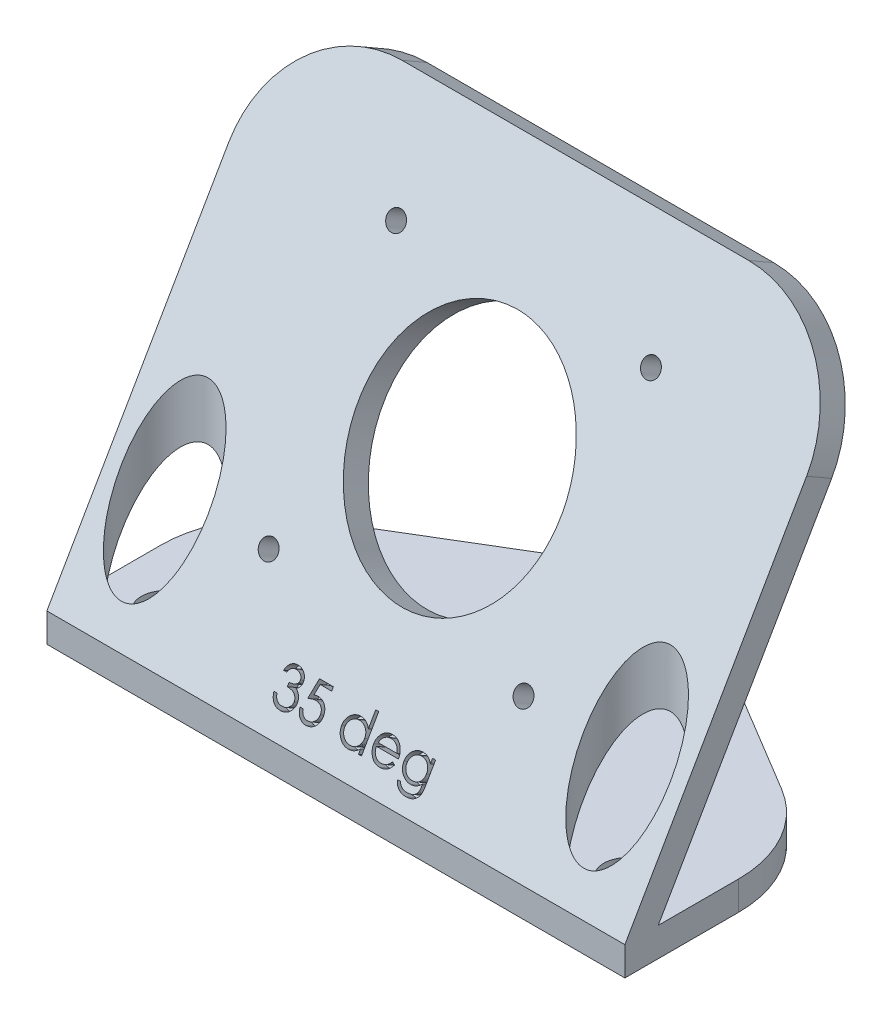
from build123d import *

# Parameters (mm, degrees)
BOSS_EXTRUDE1_DEPTH                             = 3.175
BOSS_EXTRUDE2_DEPTH                             = 31.75
FILLET1_R                                       = 6.35
SKETCH11_W                                      = 2.45745
SKETCH11_H                                      = 3.175
F_10_0_1935_DIAMETER_HOLE1_AT_2_COUNT           = 2
F_10_0_1935_DIAMETER_HOLE1_AT_2_PITCH           = 35.921024484
F_10_0_1935_DIAMETER_HOLE1_AT_3_COUNT           = 2
F_10_0_1935_DIAMETER_HOLE1_AT_3_PITCH           = 35.921024484
CUT_EXTRUDE2_REACH                              = 74.662
SKETCH13_RX                                     = 12.7
SKETCH13_RY                                     = 11.1125
CUT_EXTRUDE3_DEPTH                              = 1.27
SKETCH16_W                                      = 1.025
SKETCH16_H                                      = 25.965795256
M2_5X0_45_TAPPED_HOLE1_AT_2_COUNT               = 2
M2_5X0_45_TAPPED_HOLE1_AT_2_PITCH               = 28
M2_5X0_45_TAPPED_HOLE1_AT_3_COUNT               = 2
M2_5X0_45_TAPPED_HOLE1_AT_3_PITCH               = 28
M2_5X0_45_TAPPED_HOLE1_AT_4_COUNT               = 2
M2_5X0_45_TAPPED_HOLE1_AT_4_PITCH               = 39.597979746
BOSS_EXTRUDE3_START                             = 2.54
SKETCH19_R                                      = 2.38125
SKETCH19_R_2                                    = 1.025
BOSS_EXTRUDE3_DEPTH                             = 2.54
FILLET2_R                                       = 2.54
CBORE_FOR_10_SOCKET_HEAD_CAP_SCREW2_D           = 5.1054
CBORE_FOR_10_SOCKET_HEAD_CAP_SCREW2_CBORE_D     = 9.525
CBORE_FOR_10_SOCKET_HEAD_CAP_SCREW2_CBORE_DEPTH = 25.4
SKETCH23_W                                      = 6.35
SKETCH23_H                                      = 20.32
CUT_EXTRUDE4_DEPTH                              = 71.366754271
FILLET3_R                                       = 12.7


with BuildPart() as part:
    # Sketch1 → Boss-Extrude1 (new body)
    with BuildSketch(Plane(origin=(0, 0, 0), x_dir=(1, 0, 0), z_dir=(0, 1, 0))):
        Polygon((0, 38.770250599), (-38.1, 15.875), (-38.1, 0), (38.1, 0), (38.1, 15.875), align=None)
    extrude(amount=BOSS_EXTRUDE1_DEPTH)

    # Sketch3 → Boss-Extrude2 (add, symmetric)
    with BuildSketch(Plane(origin=(0, 0, 0), x_dir=(0, 0, -1), z_dir=(1, 0, 0))):
        Polygon((0, 3.175), (26.316543552, 48.756590512), (29.066174209, 47.169090512), (3.666174209, 3.175), align=None)
    extrude(amount=BOSS_EXTRUDE2_DEPTH, both=True)

    # Fillet1
    fillet1_edges = [part.edges().sort_by_distance(p)[0] for p in [
        (0, 1.5875, -38.770250599),
    ]]
    fillet(fillet1_edges, radius=FILLET1_R)

    # Sketch11 → #10 (0.1935) Diameter Hole1 (revolve, cut)
    with BuildSketch(Plane(origin=(0, 3.175, -31.996917266), x_dir=(0, 0, 1), z_dir=(1, 0, 0))):
        with Locations((1.228725, 1.5875)):
            Rectangle(SKETCH11_W, SKETCH11_H)
    f_10_0_1935_diameter_hole1 = revolve(axis=Axis((0, 9.525, -31.996917266), (0, -1, 0)), mode=Mode.SUBTRACT)

    # #10 (0.1935) Diameter Hole1 at 2: #10 (0.1935) Diameter Hole1 ×2
    with Locations(*[Vector(0.7071067811865541, 0, 0.7071067811865409) * (i * F_10_0_1935_DIAMETER_HOLE1_AT_2_PITCH) for i in range(1, F_10_0_1935_DIAMETER_HOLE1_AT_2_COUNT)]):
        add(f_10_0_1935_diameter_hole1, mode=Mode.SUBTRACT)

    # #10 (0.1935) Diameter Hole1 at 3: #10 (0.1935) Diameter Hole1 ×2
    with Locations(*[Vector(-0.707106781186551, 0, 0.707106781186544) * (i * F_10_0_1935_DIAMETER_HOLE1_AT_3_PITCH) for i in range(1, F_10_0_1935_DIAMETER_HOLE1_AT_3_COUNT)]):
        add(f_10_0_1935_diameter_hole1, mode=Mode.SUBTRACT)

    # Sketch13 → Cut-Extrude2 (cut, up to next)
    with BuildSketch(Plane(origin=(0, 0.79375, 1.374815329), x_dir=(1, 0, 0), z_dir=(0, 0.4999999999999981, 0.8660254037844397)), mode=Mode.PRIVATE) as cut_extrude2_sk1:
        with Locations(Location((0, 29.982717762), (0, 0, -90))):
            Ellipse(SKETCH13_RX, SKETCH13_RY)
    cut_extrude2_tool1 = extrude(cut_extrude2_sk1.sketch, amount=-CUT_EXTRUDE2_REACH, mode=Mode.PRIVATE) & part.part
    add(cut_extrude2_tool1.solids().sort_by_distance((0, 26.759545, -13.616544))[0], mode=Mode.SUBTRACT)

    # Sketch14 → Cut-Extrude3 (cut)
    # profile 1 of 5: a face of its own
    with BuildSketch(Plane(origin=(0, 0.79375, 1.374815329), x_dir=(1, 0, 0), z_dir=(0, 0.4999999999999981, 0.8660254037844397))):
        with BuildLine():
            Line((-8.096928419, 8.138989631), (-8.429353632, 8.138989631))
            add(Edge.make_bspline(
                [(-8.429353632, 8.138989631), (-8.420347691, 8.176277344), (-8.402741813, 8.249171771), (-8.366020214, 8.353319455), (-8.326016003, 8.451875182), (-8.2779792, 8.542993527), (-8.225582435, 8.628505699), (-8.165550889, 8.706472189), (-8.100654182, 8.778875911), (-8.028872777, 8.843130754), (-7.953594944, 8.901315517), (-7.873759971, 8.950924953), (-7.790974076, 8.993601348), (-7.704663676, 9.028759427), (-7.614571811, 9.055244773), (-7.52151296, 9.074460725), (-7.425243256, 9.086939655), (-7.359893722, 9.088157545), (-7.326711071, 9.088775956)],
                knots=[0, 0, 0, 0, 1.162005537, 2.271625781, 3.343758855, 4.383309926, 5.390229558, 6.379919256, 7.361854164, 8.333198761, 9.295911338, 10.242430842, 11.177959212, 12.116337295, 13.062827104, 14.020064771, 14.994644689, 16, 16, 16, 16], degree=3))
            add(Edge.make_bspline(
                [(-7.326711071, 9.088775956), (-7.278363502, 9.087316271), (-7.182722966, 9.08442874), (-7.042215408, 9.058060962), (-6.906720358, 9.01633603), (-6.777720904, 8.958684669), (-6.657898062, 8.887578095), (-6.551285598, 8.802948749), (-6.459328591, 8.706429488), (-6.382182041, 8.599820858), (-6.321777667, 8.485885443), (-6.277236255, 8.368621944), (-6.250119976, 8.248308524), (-6.24660572, 8.167073737), (-6.244845085, 8.126375282)],
                knots=[0, 0, 0, 0, 1.083050992, 2.142477498, 3.193116406, 4.255571735, 5.30263384, 6.308962982, 7.297363603, 8.282367274, 9.249857812, 10.179914175, 11.08814088, 12, 12, 12, 12], degree=3))
            add(Edge.make_bspline(
                [(-6.244845085, 8.126375282), (-6.246076553, 8.087209757), (-6.248486343, 8.010568904), (-6.268947848, 7.898680319), (-6.303382059, 7.793226292), (-6.351080892, 7.693762896), (-6.412825699, 7.600920774), (-6.48762097, 7.514491039), (-6.57599462, 7.434090347), (-6.64296483, 7.388032238), (-6.677443076, 7.36432016)],
                knots=[0, 0, 0, 0, 1.024540389, 2.004866551, 2.965041327, 3.920577974, 4.882998113, 5.874504559, 6.905732034, 8, 8, 8, 8], degree=3))
            add(Edge.make_bspline(
                [(-6.677443076, 7.36432016), (-6.638039469, 7.345293262), (-6.559969527, 7.307595474), (-6.45355355, 7.233664797), (-6.356951132, 7.148303496), (-6.303078029, 7.081689188), (-6.276009949, 7.048219399)],
                knots=[0, 0, 0, 0, 1.015518401, 2.012035669, 3.001164323, 4, 4, 4, 4], degree=3))
            add(Edge.make_bspline(
                [(-6.276009949, 7.048219399), (-6.258186195, 7.023816612), (-6.222830564, 6.97541065), (-6.179189624, 6.897584599), (-6.139598311, 6.81889594), (-6.108747662, 6.737235569), (-6.084856987, 6.653549962), (-6.067779686, 6.567695427), (-6.057170803, 6.479601853), (-6.055651511, 6.420004478), (-6.054887821, 6.390047157)],
                knots=[0, 0, 0, 0, 1.025084078, 2.033381695, 3.024893161, 4.013698104, 4.991890475, 5.976764909, 6.982997093, 8, 8, 8, 8], degree=3))
            add(Edge.make_bspline(
                [(-6.054887821, 6.390047157), (-6.056787014, 6.338178535), (-6.060576463, 6.234685387), (-6.094447442, 6.081782973), (-6.146954788, 5.932319316), (-6.221521712, 5.789365111), (-6.312398159, 5.655612541), (-6.420514661, 5.535940114), (-6.544642776, 5.433071591), (-6.683078754, 5.3471241), (-6.833062715, 5.278419299), (-6.993480217, 5.230733505), (-7.162019857, 5.199675656), (-7.277597581, 5.19634522), (-7.336357338, 5.194652025)],
                knots=[0, 0, 0, 0, 0.955779014, 1.907060117, 2.875433937, 3.871313158, 4.872415639, 5.851225146, 6.836215519, 7.83643374, 8.849228613, 9.86973379, 10.916971861, 12, 12, 12, 12], degree=3))
            add(Edge.make_bspline(
                [(-7.336357338, 5.194652025), (-7.375959431, 5.195570884), (-7.453883144, 5.197378892), (-7.568440847, 5.209738745), (-7.677789645, 5.232313), (-7.782077386, 5.262690665), (-7.881396716, 5.301205259), (-7.975444561, 5.349167548), (-8.064799532, 5.405588887), (-8.148618422, 5.471135268), (-8.226891239, 5.544458019), (-8.297537872, 5.626858804), (-8.361736153, 5.71681439), (-8.417767112, 5.815369625), (-8.468182887, 5.921250855), (-8.5096494, 6.035813849), (-8.546146626, 6.158034439), (-8.563115376, 6.243206714), (-8.571821581, 6.286906298)],
                knots=[0, 0, 0, 0, 1.048658725, 2.063410685, 3.046034179, 4.001477787, 4.936774919, 5.862367409, 6.792675028, 7.730719943, 8.675894397, 9.627829632, 10.600096036, 11.597688215, 12.626045268, 13.701542398, 14.82072376, 16, 16, 16, 16], degree=3))
            Line((-8.571821581, 6.286906298), (-8.239396368, 6.286906298))
            add(Edge.make_bspline(
                [(-8.239396368, 6.286906298), (-8.230735717, 6.258385259), (-8.213890001, 6.202909361), (-8.185215202, 6.123068371), (-8.152546281, 6.049876098), (-8.117500039, 5.982795627), (-8.080692851, 5.921166334), (-8.039507888, 5.866617856), (-7.996995543, 5.816754267), (-7.964949894, 5.788661219), (-7.949266326, 5.774912107)],
                knots=[0, 0, 0, 0, 1.198163088, 2.33053128, 3.407730985, 4.417276592, 5.372219308, 6.28897303, 7.162600585, 8, 8, 8, 8], degree=3))
            add(Edge.make_bspline(
                [(-7.949266326, 5.774912107), (-7.928526616, 5.758922454), (-7.887111214, 5.726992504), (-7.81962317, 5.686244947), (-7.748646165, 5.650937862), (-7.672642302, 5.623967617), (-7.59325167, 5.601131259), (-7.509191042, 5.586187043), (-7.421202037, 5.575933729), (-7.36112282, 5.575028926), (-7.330421174, 5.574566554)],
                knots=[0, 0, 0, 0, 0.946170439, 1.889420265, 2.845303464, 3.807233317, 4.801018734, 5.828864929, 6.890507805, 8, 8, 8, 8], degree=3))
            add(Edge.make_bspline(
                [(-7.330421174, 5.574566554), (-7.29575705, 5.575218388), (-7.227974349, 5.576492991), (-7.129067956, 5.588214781), (-7.034974241, 5.605286135), (-6.946737894, 5.631652375), (-6.863203107, 5.664228776), (-6.785540862, 5.705131672), (-6.712731649, 5.753121502), (-6.645708028, 5.807667112), (-6.5854407, 5.867379861), (-6.532376381, 5.929835361), (-6.487265281, 5.994770281), (-6.450875994, 6.062543958), (-6.422141662, 6.132875742), (-6.402580275, 6.205963003), (-6.388979088, 6.28120761), (-6.387871423, 6.332355769), (-6.387313034, 6.358140272)],
                knots=[0, 0, 0, 0, 1.217147791, 2.380027433, 3.494444702, 4.572153297, 5.609568379, 6.639424714, 7.649109417, 8.668170816, 9.669597737, 10.625200337, 11.543417969, 12.441394052, 13.322311151, 14.205496177, 15.095365482, 16, 16, 16, 16], degree=3))
            add(Edge.make_bspline(
                [(-6.387313034, 6.358140272), (-6.388932603, 6.392653939), (-6.392163683, 6.461509538), (-6.416831929, 6.562810638), (-6.457407227, 6.660413749), (-6.514210635, 6.752653627), (-6.583357615, 6.838141456), (-6.664177141, 6.914417108), (-6.757340349, 6.977356288), (-6.843086377, 7.020841783), (-6.919037835, 7.050514354), (-6.984035783, 7.070278691), (-7.056803189, 7.08701481), (-7.136460074, 7.102585298), (-7.223606645, 7.115837058), (-7.318148025, 7.126887979), (-7.420103373, 7.135730398), (-7.490684857, 7.13967914), (-7.527056624, 7.14171399)],
                knots=[0, 0, 0, 0, 1.07054697, 2.135767047, 3.216561865, 4.33974944, 5.486079747, 6.621378074, 7.775625952, 8.963672916, 9.598146892, 10.304877434, 11.070270905, 11.915000392, 12.823868403, 13.805723172, 14.86925407, 16, 16, 16, 16], degree=3))
            Line((-7.527056624, 7.14171399), (-7.527056624, 7.52162852))
            add(Edge.make_bspline(
                [(-7.527056624, 7.52162852), (-7.481229557, 7.522406188), (-7.39146559, 7.523929447), (-7.260344118, 7.542352924), (-7.134959862, 7.567838256), (-7.01809156, 7.606875084), (-6.911571672, 7.652214398), (-6.819158426, 7.704974653), (-6.742146529, 7.76362193), (-6.680910228, 7.829061441), (-6.634841795, 7.899244867), (-6.601158434, 7.972393329), (-6.581261422, 8.04914796), (-6.578605358, 8.101529817), (-6.577270299, 8.127859323)],
                knots=[0, 0, 0, 0, 1.321986639, 2.589447074, 3.816329219, 5.01088745, 6.139805852, 7.153945165, 8.075214402, 8.924034688, 9.728124013, 10.488707548, 11.240355623, 12, 12, 12, 12], degree=3))
            add(Edge.make_bspline(
                [(-6.577270299, 8.127859323), (-6.577708884, 8.14720327), (-6.578581428, 8.185687135), (-6.589585214, 8.241911166), (-6.606120657, 8.296416334), (-6.628853371, 8.348970849), (-6.659280664, 8.399210223), (-6.695693667, 8.447562773), (-6.739051573, 8.493752439), (-6.788735504, 8.536805777), (-6.842087998, 8.577836553), (-6.900560676, 8.612670152), (-6.962390494, 8.64245701), (-7.027645903, 8.667020399), (-7.096538673, 8.685498146), (-7.168745113, 8.698765245), (-7.244402912, 8.707060096), (-7.296019661, 8.708254336), (-7.322258948, 8.708861426)],
                knots=[0, 0, 0, 0, 0.884392785, 1.759457502, 2.611959086, 3.489218968, 4.37281399, 5.2945488, 6.255912374, 7.266815255, 8.301784654, 9.332968512, 10.37626691, 11.440494194, 12.520033166, 13.637162961, 14.798855837, 16, 16, 16, 16], degree=3))
            add(Edge.make_bspline(
                [(-7.322258948, 8.708861426), (-7.364435296, 8.707388901), (-7.446815515, 8.704512718), (-7.565576302, 8.679321196), (-7.67598093, 8.639127724), (-7.760371019, 8.591150278), (-7.82268841, 8.543789402), (-7.867219836, 8.50242721), (-7.91095071, 8.456460805), (-7.951004051, 8.403059025), (-7.991510676, 8.345838338), (-8.028387837, 8.281889942), (-8.064222678, 8.212881958), (-8.085815377, 8.164097412), (-8.096928419, 8.138989631)],
                knots=[0, 0, 0, 0, 1.472543308, 2.876219568, 4.221790263, 5.565193594, 6.249813518, 6.953379497, 7.687249741, 8.463570142, 9.283606569, 10.136032583, 11.040678096, 12, 12, 12, 12], degree=3))
        make_face()
    # profile 2 of 5: a face of its own
    with BuildSketch(Plane(origin=(0, 0.79375, 1.374815329), x_dir=(1, 0, 0), z_dir=(0, 0.4999999999999981, 0.8660254037844397))):
        with BuildLine():
            Line((-3.395486111, 8.993797324), (-3.395486111, 8.613882794))
            Line((-3.395486111, 8.613882794), (-4.655437033, 8.613882794))
            Line((-4.655437033, 8.613882794), (-4.855040565, 7.63960979))
            add(Edge.make_bspline(
                [(-4.855040565, 7.63960979), (-4.815823098, 7.650436828), (-4.739845458, 7.671412501), (-4.627704605, 7.694701941), (-4.521244523, 7.708741203), (-4.452161423, 7.710658173), (-4.418732472, 7.711585785)],
                knots=[0, 0, 0, 0, 1.100273476, 2.13160584, 3.095893838, 4, 4, 4, 4], degree=3))
            add(Edge.make_bspline(
                [(-4.418732472, 7.711585785), (-4.377368847, 7.710690503), (-4.296037627, 7.708930155), (-4.177039741, 7.692026615), (-4.063445763, 7.665420205), (-3.955493254, 7.628250986), (-3.852982505, 7.580721519), (-3.756856669, 7.521349082), (-3.665672878, 7.451992973), (-3.581066966, 7.372252835), (-3.504312073, 7.284494124), (-3.436826401, 7.190135377), (-3.379504326, 7.090093601), (-3.333402527, 6.983412957), (-3.296589106, 6.871272853), (-3.272086579, 6.75249337), (-3.255770562, 6.62819411), (-3.253947703, 6.543205106), (-3.253018162, 6.499866201)],
                knots=[0, 0, 0, 0, 1.052922333, 2.070308379, 3.05430497, 4.020497103, 4.973039431, 5.925935799, 6.892292201, 7.88610001, 8.88166317, 9.857072816, 10.836096531, 11.812156883, 12.81219415, 13.836441305, 14.89672472, 16, 16, 16, 16], degree=3))
            add(Edge.make_bspline(
                [(-3.253018162, 6.499866201), (-3.253722034, 6.469680184), (-3.255120264, 6.409716089), (-3.262230769, 6.320663476), (-3.275921069, 6.233496145), (-3.29430191, 6.14820253), (-3.318159303, 6.064944111), (-3.347040218, 5.983482577), (-3.382384347, 5.904324952), (-3.421152553, 5.826722242), (-3.464805075, 5.752428822), (-3.513253995, 5.682950311), (-3.564440807, 5.617244447), (-3.61951794, 5.556015913), (-3.678997326, 5.499667052), (-3.742158625, 5.447863454), (-3.808497836, 5.399729046), (-3.8790413, 5.357217706), (-3.952217095, 5.318098578), (-4.029081958, 5.286006167), (-4.107886199, 5.257314192), (-4.189764026, 5.234444108), (-4.274529978, 5.216523822), (-4.362323782, 5.204352353), (-4.452684991, 5.19548729), (-4.513936046, 5.194932345), (-4.544875968, 5.194652025)],
                knots=[0, 0, 0, 0, 1.056347294, 2.098418968, 3.122841568, 4.141288669, 5.149314143, 6.15115421, 7.162517403, 8.180376062, 9.185164535, 10.17417709, 11.141909838, 12.097768115, 13.052685741, 14.0056014, 14.954263652, 15.917497458, 16.885230207, 17.854509472, 18.828990115, 19.81800267, 20.826176721, 21.857883937, 22.917946725, 24, 24, 24, 24], degree=3))
            add(Edge.make_bspline(
                [(-4.544875968, 5.194652025), (-4.581784476, 5.195383161), (-4.654397605, 5.196821587), (-4.760781872, 5.211869484), (-4.863138163, 5.233421295), (-4.96064252, 5.265844681), (-5.054168774, 5.306471234), (-5.142457817, 5.357817516), (-5.227765597, 5.416003734), (-5.306624169, 5.484668774), (-5.379814389, 5.559721204), (-5.445332111, 5.641168041), (-5.503681813, 5.727665034), (-5.553929095, 5.819632247), (-5.596789501, 5.916828026), (-5.630460364, 6.019616535), (-5.657636623, 6.127460706), (-5.669133743, 6.201706504), (-5.674973291, 6.239416982)],
                knots=[0, 0, 0, 0, 1.0467383, 2.05933395, 3.04377827, 4.011590433, 4.970194871, 5.932262533, 6.905835911, 7.896367577, 8.894135286, 9.877477877, 10.858688626, 11.851381753, 12.8477658, 13.868841284, 14.917554742, 16, 16, 16, 16], degree=3))
            Line((-5.674973291, 6.239416982), (-5.342548077, 6.239416982))
            add(Edge.make_bspline(
                [(-5.342548077, 6.239416982), (-5.334368687, 6.20409357), (-5.318647445, 6.13620001), (-5.284139695, 6.040811007), (-5.24194831, 5.955806495), (-5.191778708, 5.88006202), (-5.131929925, 5.814012498), (-5.06363628, 5.755151107), (-4.987068273, 5.702049095), (-4.901985438, 5.657786667), (-4.812224929, 5.620037236), (-4.718279632, 5.594900025), (-4.622707532, 5.577224914), (-4.558066257, 5.575455634), (-4.525583433, 5.574566554)],
                knots=[0, 0, 0, 0, 1.136247022, 2.183929868, 3.172523383, 4.106158343, 5.02341133, 5.958108904, 6.928429099, 7.938127109, 8.96079061, 9.975095812, 10.982467395, 12, 12, 12, 12], degree=3))
            add(Edge.make_bspline(
                [(-4.525583433, 5.574566554), (-4.493877413, 5.575435211), (-4.431448, 5.577145603), (-4.339572615, 5.590310224), (-4.250870657, 5.61058532), (-4.166217371, 5.640927584), (-4.084131408, 5.677804911), (-4.006689168, 5.725128366), (-3.93165029, 5.779590219), (-3.861347182, 5.841985986), (-3.796958764, 5.910745579), (-3.74006687, 5.98427582), (-3.69267797, 6.06271615), (-3.652742704, 6.14470857), (-3.622417963, 6.231151709), (-3.600784591, 6.321640453), (-3.588081354, 6.416398307), (-3.586333855, 6.481029993), (-3.585443376, 6.513964591)],
                knots=[0, 0, 0, 0, 1.027316725, 2.022795036, 3.002884548, 3.971462791, 4.93288096, 5.914575861, 6.907176829, 7.935150275, 8.956128384, 9.956726525, 10.942570165, 11.921478529, 12.907843606, 13.90538589, 14.932640048, 16, 16, 16, 16], degree=3))
            add(Edge.make_bspline(
                [(-3.585443376, 6.513964591), (-3.586140267, 6.543678095), (-3.587504331, 6.601838051), (-3.598649185, 6.686927211), (-3.618034647, 6.767437848), (-3.644941587, 6.843758745), (-3.679104066, 6.915961888), (-3.720851413, 6.984121794), (-3.770967093, 7.047340101), (-3.828214341, 7.105646386), (-3.890929101, 7.159457212), (-3.960190396, 7.205329704), (-4.034548818, 7.243920683), (-4.113108478, 7.277224315), (-4.197737995, 7.301143437), (-4.286761431, 7.319101116), (-4.381140114, 7.329489041), (-4.445667425, 7.330930373), (-4.478836138, 7.331671255)],
                knots=[0, 0, 0, 0, 1.045622112, 2.046656509, 3.013763289, 3.955457236, 4.890082067, 5.820317437, 6.762574623, 7.722996705, 8.69280354, 9.665887285, 10.63943826, 11.638615906, 12.663482002, 13.728887084, 14.832589034, 16, 16, 16, 16], degree=3))
            add(Edge.make_bspline(
                [(-4.478836138, 7.331671255), (-4.507547587, 7.331056796), (-4.566829447, 7.329788094), (-4.657764438, 7.320446719), (-4.753323179, 7.305376799), (-4.853139353, 7.28464802), (-4.957512724, 7.257521797), (-5.066223032, 7.225015617), (-5.179498847, 7.186151502), (-5.255823439, 7.156801576), (-5.295058761, 7.14171399)],
                knots=[0, 0, 0, 0, 0.817624296, 1.688186739, 2.600797293, 3.572016777, 4.590301741, 5.671205678, 6.80286297, 8, 8, 8, 8], degree=3))
            Line((-5.295058761, 7.14171399), (-4.915144231, 8.993797324))
            Line((-4.915144231, 8.993797324), (-3.395486111, 8.993797324))
        make_face()
    # profile 3 of 5: a face of its own
    with BuildSketch(Plane(origin=(0, 0.79375, 1.374815329), x_dir=(1, 0, 0), z_dir=(0, 0.4999999999999981, 0.8660254037844397))):
        with BuildLine():
            Line((1.543402778, 9.088775956), (1.543402778, 5.289630657))
            Line((1.543402778, 5.289630657), (1.210977564, 5.289630657))
            Line((1.210977564, 5.289630657), (1.210977564, 5.757845634))
            add(Edge.make_bspline(
                [(1.210977564, 5.757845634), (1.173492677, 5.715470397), (1.10034045, 5.63277459), (0.978165266, 5.524737624), (0.848658945, 5.435437233), (0.712450047, 5.363311906), (0.569661572, 5.309133646), (0.420610047, 5.270624961), (0.265234669, 5.245866486), (0.15913426, 5.243394196), (0.10536692, 5.242141341)],
                knots=[0, 0, 0, 0, 1.074387032, 2.096679803, 3.090159297, 4.057316773, 5.018401886, 5.985159533, 6.978961417, 8, 8, 8, 8], degree=3))
            add(Edge.make_bspline(
                [(0.10536692, 5.242141341), (0.057564169, 5.243439251), (-0.036704973, 5.245998789), (-0.175377413, 5.26585556), (-0.308825043, 5.297743801), (-0.437173966, 5.342088909), (-0.559593653, 5.400911946), (-0.677132256, 5.471334766), (-0.789180855, 5.555197978), (-0.894031567, 5.651070308), (-0.990585434, 5.755205003), (-1.075316947, 5.866272373), (-1.145963957, 5.983792145), (-1.205040209, 6.1062764), (-1.250544673, 6.234668023), (-1.28226677, 6.368523026), (-1.302100409, 6.507683142), (-1.304658888, 6.602445804), (-1.305956197, 6.650496375)],
                knots=[0, 0, 0, 0, 1.033919861, 2.038935746, 3.024066025, 3.998881131, 4.97069526, 5.957263378, 6.95902576, 7.993208707, 9.027059324, 10.027763471, 11.009749337, 11.988697705, 12.965288445, 13.950418724, 14.960734635, 16, 16, 16, 16], degree=3))
            add(Edge.make_bspline(
                [(-1.305956197, 6.650496375), (-1.304630135, 6.697553795), (-1.302008583, 6.790583775), (-1.282478926, 6.92740373), (-1.249637775, 7.059185556), (-1.203549636, 7.185504988), (-1.144450234, 7.306514874), (-1.072559675, 7.422300801), (-0.987872768, 7.533181747), (-0.890238971, 7.636550462), (-0.784474672, 7.732033945), (-0.671329599, 7.815016851), (-0.553618293, 7.88668385), (-0.42951494, 7.943467112), (-0.300856421, 7.989408415), (-0.166497357, 8.021193306), (-0.02699677, 8.039922971), (0.067714001, 8.042635229), (0.115755208, 8.044010999)],
                knots=[0, 0, 0, 0, 1.020392517, 2.01726096, 2.990465484, 3.961182959, 4.928053699, 5.906110375, 6.912531644, 7.948652711, 8.985773172, 9.998621852, 10.987621588, 11.969261332, 12.953316658, 13.946091881, 14.958173133, 16, 16, 16, 16], degree=3))
            add(Edge.make_bspline(
                [(0.115755208, 8.044010999), (0.171017997, 8.042352489), (0.279492708, 8.039097018), (0.43813531, 8.011891113), (0.588193865, 7.966210401), (0.730532276, 7.903672128), (0.864301969, 7.822391333), (0.990483497, 7.724229384), (1.106882514, 7.606408154), (1.175750193, 7.517919239), (1.210977564, 7.472655163)],
                knots=[0, 0, 0, 0, 1.031072012, 2.023879775, 2.993683497, 3.952812103, 4.918022106, 5.908088563, 6.929940113, 8, 8, 8, 8], degree=3))
            Line((1.210977564, 7.472655163), (1.210977564, 9.088775956))
            Line((1.210977564, 9.088775956), (1.543402778, 9.088775956))
        make_face()
        with BuildLine():
            add(Edge.make_bspline(
                [(0.120207332, 7.711585785), (0.071614657, 7.709856852), (-0.024299552, 7.706444213), (-0.165104455, 7.679802264), (-0.299844485, 7.635474401), (-0.427845747, 7.574851056), (-0.547086276, 7.498620643), (-0.653653744, 7.406417179), (-0.74841977, 7.300756339), (-0.828121016, 7.182114939), (-0.893092625, 7.054926459), (-0.938777734, 6.921973929), (-0.968907688, 6.785655328), (-0.971985872, 6.693196485), (-0.973530983, 6.646786273)],
                knots=[0, 0, 0, 0, 1.031046209, 2.035121221, 3.029706178, 4.034933723, 5.034054252, 6.02443088, 7.017295772, 8.038157696, 9.050218397, 10.03989886, 11.016116709, 12, 12, 12, 12], degree=3))
            add(Edge.make_bspline(
                [(-0.973530983, 6.646786273), (-0.971557304, 6.600653409), (-0.967617683, 6.508568508), (-0.939306531, 6.372064064), (-0.891808665, 6.239080203), (-0.826994149, 6.110745651), (-0.745834138, 5.991594145), (-0.651760314, 5.883919182), (-0.543862933, 5.791326034), (-0.424347988, 5.713816269), (-0.296704552, 5.651202601), (-0.162471975, 5.607635633), (-0.024173591, 5.579507481), (0.069861796, 5.57622191), (0.117239249, 5.574566554)],
                knots=[0, 0, 0, 0, 0.979072187, 1.954306742, 2.945804271, 3.96968567, 4.997920485, 5.998718438, 6.996577872, 8.005894225, 9.015743152, 10.005417472, 10.995077863, 12, 12, 12, 12], degree=3))
            add(Edge.make_bspline(
                [(0.117239249, 5.574566554), (0.165336798, 5.57632335), (0.260998052, 5.579817441), (0.402220685, 5.606573447), (0.53926952, 5.650778758), (0.67027767, 5.712055334), (0.792320576, 5.787998536), (0.90185583, 5.87690604), (0.994476896, 5.980308577), (1.072997408, 6.093948656), (1.134566391, 6.218527186), (1.179414387, 6.351172538), (1.20592977, 6.49188933), (1.209271701, 6.588053652), (1.210977564, 6.637140005)],
                knots=[0, 0, 0, 0, 1.01762866, 2.023962475, 3.030623092, 4.058876274, 5.077231937, 6.066672613, 7.034107872, 8.005628644, 8.981990164, 9.965428785, 10.961468474, 12, 12, 12, 12], degree=3))
            add(Edge.make_bspline(
                [(1.210977564, 6.637140005), (1.209961928, 6.674539209), (1.207962834, 6.748152678), (1.192690481, 6.856237634), (1.168396518, 6.959672494), (1.134163488, 7.058566007), (1.089193545, 7.152371398), (1.034956326, 7.241762211), (0.970498058, 7.326273526), (0.896856372, 7.40474161), (0.816248199, 7.476312949), (0.73095231, 7.540198437), (0.639958136, 7.592679888), (0.544795939, 7.636115234), (0.44530061, 7.670679501), (0.340662537, 7.693738143), (0.231993943, 7.70957115), (0.157861867, 7.710907169), (0.120207332, 7.711585785)],
                knots=[0, 0, 0, 0, 1.050140795, 2.067009409, 3.05949893, 4.030605086, 5.00011959, 5.97591094, 6.962425594, 7.979863591, 8.993523472, 9.986985069, 10.967611495, 11.937549037, 12.921786183, 13.919465291, 14.943216303, 16, 16, 16, 16], degree=3))
        make_face(mode=Mode.SUBTRACT)
    # profile 4 of 5: a face of its own
    with BuildSketch(Plane(origin=(0, 0.79375, 1.374815329), x_dir=(1, 0, 0), z_dir=(0, 0.4999999999999981, 0.8660254037844397))):
        with BuildLine():
            Line((4.524841413, 6.144438349), (4.820165598, 5.989356051))
            add(Edge.make_bspline(
                [(4.820165598, 5.989356051), (4.796631868, 5.947611859), (4.750844549, 5.866394192), (4.672103758, 5.754812139), (4.589562148, 5.65443164), (4.499493782, 5.567934423), (4.404593371, 5.492526707), (4.304334645, 5.426552509), (4.198195646, 5.370335408), (4.086171354, 5.322972316), (3.967320996, 5.286555602), (3.841356558, 5.260833634), (3.708036725, 5.244934009), (3.616653685, 5.243087068), (3.569860944, 5.242141341)],
                knots=[0, 0, 0, 0, 1.120438281, 2.179929193, 3.190490725, 4.156257408, 5.095198341, 6.022838206, 6.959905092, 7.901321166, 8.864066838, 9.862729781, 10.905609505, 12, 12, 12, 12], degree=3))
            add(Edge.make_bspline(
                [(3.569860944, 5.242141341), (3.517852351, 5.243355435), (3.416398654, 5.24572378), (3.268719088, 5.266141638), (3.12967587, 5.299449885), (2.999276817, 5.345980083), (2.877841267, 5.406757334), (2.765127862, 5.480797786), (2.660543864, 5.567721088), (2.567384909, 5.668280158), (2.483518467, 5.775893563), (2.40951364, 5.888030207), (2.347646193, 6.004407953), (2.29731968, 6.124285924), (2.256674531, 6.246908545), (2.228346436, 6.373391515), (2.21201662, 6.503392508), (2.209514248, 6.591337188), (2.208253205, 6.635655964)],
                knots=[0, 0, 0, 0, 1.145258523, 2.234067595, 3.276747158, 4.290159414, 5.277019952, 6.260822364, 7.254936242, 8.264827045, 9.274100331, 10.257902744, 11.220704747, 12.172965371, 13.118907548, 14.062713208, 15.023725156, 16, 16, 16, 16], degree=3))
            add(Edge.make_bspline(
                [(2.208253205, 6.635655964), (2.20937413, 6.677242993), (2.211595654, 6.759662992), (2.225598238, 6.88165236), (2.250414348, 7.000215806), (2.284467624, 7.115451847), (2.328442693, 7.227167538), (2.382240125, 7.335430872), (2.445943725, 7.440126645), (2.495127304, 7.506169962), (2.519901843, 7.539437014)],
                knots=[0, 0, 0, 0, 1.024358464, 2.0301432, 3.019427413, 4.004406732, 4.986367066, 5.972626655, 6.978780325, 8, 8, 8, 8], degree=3))
            add(Edge.make_bspline(
                [(2.519901843, 7.539437014), (2.553459141, 7.579514901), (2.619510726, 7.658401111), (2.731224535, 7.762052505), (2.852192243, 7.848882167), (2.980897881, 7.920856387), (3.118837316, 7.97554433), (3.264156315, 8.016298187), (3.418509561, 8.039134916), (3.524030919, 8.04236054), (3.57802317, 8.044010999)],
                knots=[0, 0, 0, 0, 1.030682036, 2.02871468, 2.997146059, 3.962720338, 4.930598197, 5.918074684, 6.934738563, 8, 8, 8, 8], degree=3))
            add(Edge.make_bspline(
                [(3.57802317, 8.044010999), (3.633530219, 8.042577964), (3.742422396, 8.039766676), (3.901206391, 8.013703806), (4.051448149, 7.972373186), (4.19308755, 7.914002091), (4.326138952, 7.838691565), (4.449737522, 7.745408116), (4.565997039, 7.637015641), (4.633633618, 7.553657911), (4.668051382, 7.511240232)],
                knots=[0, 0, 0, 0, 1.056321875, 2.072262726, 3.055038591, 4.01806755, 4.982017516, 5.957941055, 6.960871419, 8, 8, 8, 8], degree=3))
            add(Edge.make_bspline(
                [(4.668051382, 7.511240232), (4.691469059, 7.479274775), (4.738148536, 7.415556633), (4.796618384, 7.311658825), (4.847373294, 7.202956779), (4.887942344, 7.087693382), (4.920792483, 6.967234326), (4.944559283, 6.840718466), (4.958497129, 6.708183477), (4.961236834, 6.617879539), (4.962633547, 6.571842195)],
                knots=[0, 0, 0, 0, 0.94817472, 1.890038105, 2.849395472, 3.817997239, 4.812318967, 5.836947057, 6.897266129, 8, 8, 8, 8], degree=3))
            Line((4.962633547, 6.571842195), (2.540678419, 6.571842195))
            add(Edge.make_bspline(
                [(2.540678419, 6.571842195), (2.542307836, 6.536175871), (2.545512018, 6.466039482), (2.560450545, 6.36341207), (2.583997163, 6.265650283), (2.617090255, 6.173487397), (2.657165999, 6.085719678), (2.70625755, 6.002998189), (2.764825244, 5.925699713), (2.830151609, 5.853132826), (2.902866619, 5.788510187), (2.979365859, 5.73067039), (3.060744882, 5.682192801), (3.146362021, 5.642844084), (3.236078827, 5.612039899), (3.329923566, 5.591013123), (3.427711573, 5.576929768), (3.494371475, 5.575363789), (3.528307792, 5.574566554)],
                knots=[0, 0, 0, 0, 1.094153842, 2.151609401, 3.174256925, 4.172055639, 5.149267565, 6.128595816, 7.11444997, 8.118368179, 9.117203808, 10.09244225, 11.054858984, 12.015122123, 12.976791628, 13.957293641, 14.960065497, 16, 16, 16, 16], degree=3))
            add(Edge.make_bspline(
                [(3.528307792, 5.574566554), (3.561487757, 5.575210081), (3.627323172, 5.576486961), (3.725368079, 5.588903234), (3.821824079, 5.608980109), (3.916291953, 5.636380348), (4.006854431, 5.669799183), (4.090722638, 5.710124708), (4.1678542, 5.75473319), (4.239944656, 5.805755096), (4.309869791, 5.868205427), (4.379235589, 5.946136565), (4.453611714, 6.038304199), (4.500167366, 6.107673362), (4.524841413, 6.144438349)],
                knots=[0, 0, 0, 0, 0.99110716, 1.966546729, 2.947904876, 3.932708344, 4.903319531, 5.828989031, 6.710028674, 7.56322171, 8.463672341, 9.504779593, 10.677557249, 12, 12, 12, 12], degree=3))
        make_face()
        with BuildLine():
            add(Edge.make_bspline(
                [(4.630208333, 6.904267409), (4.618041072, 6.948360617), (4.594623012, 7.033225849), (4.545689526, 7.150744125), (4.490580479, 7.25518882), (4.425364146, 7.345760598), (4.351472662, 7.426197649), (4.266123177, 7.496490652), (4.170411856, 7.559374121), (4.064833432, 7.612452183), (3.95302921, 7.657632284), (3.83597099, 7.687927198), (3.716529831, 7.70868063), (3.635742711, 7.710613261), (3.595089643, 7.711585785)],
                knots=[0, 0, 0, 0, 1.154881502, 2.222775134, 3.210006277, 4.132804581, 5.035138423, 5.962687519, 6.919655026, 7.923214229, 8.944639381, 9.960483929, 10.97369054, 12, 12, 12, 12], degree=3))
            add(Edge.make_bspline(
                [(3.595089643, 7.711585785), (3.561911488, 7.710938433), (3.496325249, 7.709658753), (3.399698285, 7.697519533), (3.306903937, 7.677453697), (3.217257508, 7.649974118), (3.131933755, 7.613346681), (3.049177626, 7.570396099), (2.971093373, 7.517964589), (2.922260502, 7.478003135), (2.897590311, 7.457814752)],
                knots=[0, 0, 0, 0, 1.04873581, 2.073130211, 3.073294108, 4.04793562, 5.032784715, 6.005352987, 6.992311501, 8, 8, 8, 8], degree=3))
            add(Edge.make_bspline(
                [(2.897590311, 7.457814752), (2.879923254, 7.441839934), (2.844169437, 7.409510797), (2.796395719, 7.353811554), (2.750654052, 7.293749484), (2.709025936, 7.227026727), (2.670843824, 7.154403069), (2.635114515, 7.076491072), (2.602955562, 6.992699509), (2.584862179, 6.934308677), (2.575553385, 6.904267409)],
                knots=[0, 0, 0, 0, 0.879870761, 1.780643979, 2.707998968, 3.669668524, 4.684282772, 5.740141944, 6.837334558, 8, 8, 8, 8], degree=3))
            Line((2.575553385, 6.904267409), (4.630208333, 6.904267409))
        make_face(mode=Mode.SUBTRACT)
    # profile 5 of 5: a face of its own
    with BuildSketch(Plane(origin=(0, 0.79375, 1.374815329), x_dir=(1, 0, 0), z_dir=(0, 0.4999999999999981, 0.8660254037844397))):
        with BuildLine():
            Line((8.001949786, 7.996521683), (8.334375, 7.996521683))
            Line((8.334375, 7.996521683), (8.334375, 5.848372143))
            add(Edge.make_bspline(
                [(8.334375, 5.848372143), (8.334081797, 5.802612356), (8.333515843, 5.714284943), (8.329440232, 5.586567097), (8.320845849, 5.468598823), (8.311099994, 5.3598421), (8.297080553, 5.260801033), (8.279960564, 5.171180091), (8.260661137, 5.090893271), (8.243706407, 5.041442815), (8.235686265, 5.01805113)],
                knots=[0, 0, 0, 0, 1.307562039, 2.523909702, 3.650326591, 4.686913197, 5.643429486, 6.506965704, 7.293745905, 8, 8, 8, 8], degree=3))
            add(Edge.make_bspline(
                [(8.235686265, 5.01805113), (8.22384432, 4.987645296), (8.200514498, 4.927742744), (8.156820536, 4.842828087), (8.107889655, 4.762874825), (8.05200251, 4.688328522), (7.989411826, 4.619563407), (7.921592247, 4.555085507), (7.847222961, 4.49625893), (7.766346491, 4.444098657), (7.680827195, 4.397122358), (7.590714237, 4.356433074), (7.496515757, 4.320992832), (7.397346863, 4.294446873), (7.294762365, 4.271444294), (7.187555917, 4.256474501), (7.076353874, 4.246285865), (7.000740847, 4.245343701), (6.962378973, 4.2448657)],
                knots=[0, 0, 0, 0, 0.981931301, 1.934503488, 2.87077864, 3.801706999, 4.735015492, 5.667491629, 6.616593066, 7.585388521, 8.561939025, 9.551802639, 10.560317337, 11.588439944, 12.640189604, 13.723962949, 14.845264515, 16, 16, 16, 16], degree=3))
            add(Edge.make_bspline(
                [(6.962378973, 4.2448657), (6.906409296, 4.245772147), (6.797085478, 4.247542683), (6.637695194, 4.268170568), (6.486316782, 4.297332279), (6.344950482, 4.341470524), (6.21448963, 4.395484671), (6.095825195, 4.457497663), (5.990022439, 4.528606348), (5.894641552, 4.609569484), (5.808555036, 4.70583938), (5.727563654, 4.81929149), (5.649605824, 4.951653948), (5.603919015, 5.048801236), (5.579994658, 5.099673392)],
                knots=[0, 0, 0, 0, 1.157897085, 2.2616841, 3.32207898, 4.345638746, 5.321241055, 6.241986252, 7.112515963, 7.955008012, 8.825025602, 9.77857164, 10.836726669, 12, 12, 12, 12], degree=3))
            Line((5.579994658, 5.099673392), (5.912419872, 5.099673392))
            add(Edge.make_bspline(
                [(5.912419872, 5.099673392), (5.93915571, 5.057228007), (5.991420981, 4.974252506), (6.089156457, 4.866817749), (6.196266486, 4.775003771), (6.316365817, 4.701014869), (6.44995417, 4.645230339), (6.597111913, 4.605463151), (6.759036513, 4.581654602), (6.871768289, 4.578785149), (6.930472089, 4.577290913)],
                knots=[0, 0, 0, 0, 0.997731894, 1.950442991, 2.880492273, 3.800895997, 4.748200782, 5.754801363, 6.83083817, 8, 8, 8, 8], degree=3))
            add(Edge.make_bspline(
                [(6.930472089, 4.577290913), (6.988433714, 4.578804488), (7.100177927, 4.581722507), (7.260865914, 4.605473776), (7.407545557, 4.645238994), (7.539371769, 4.700916202), (7.654789124, 4.769126216), (7.754285148, 4.845326295), (7.834871597, 4.931242856), (7.889071987, 5.010386934), (7.922763624, 5.080897472), (7.944218408, 5.141595636), (7.961653359, 5.210231598), (7.97623702, 5.286575252), (7.988271237, 5.370735672), (7.995894287, 5.462905291), (8.001403771, 5.562874635), (8.001763573, 5.632188206), (8.001949786, 5.668061146)],
                knots=[0, 0, 0, 0, 1.570740765, 3.028230971, 4.391408896, 5.680370741, 6.894727393, 8.017376726, 9.065722033, 10.075533815, 10.603371122, 11.180248986, 11.817768598, 12.521299649, 13.286540596, 14.121245857, 15.027658897, 16, 16, 16, 16], degree=3))
            Line((8.001949786, 5.668061146), (8.001949786, 5.808303033))
            add(Edge.make_bspline(
                [(8.001949786, 5.808303033), (7.968208937, 5.768147959), (7.90132073, 5.688544126), (7.785806475, 5.584233061), (7.65963524, 5.49439524), (7.523021824, 5.420715518), (7.379312601, 5.36178601), (7.230064074, 5.320571377), (7.076614149, 5.293943816), (6.972630623, 5.291078573), (6.920083801, 5.289630657)],
                knots=[0, 0, 0, 0, 1.012485704, 2.007162095, 2.997754123, 3.998611389, 4.999708251, 5.992315798, 6.98544096, 8, 8, 8, 8], degree=3))
            add(Edge.make_bspline(
                [(6.920083801, 5.289630657), (6.889142082, 5.290175727), (6.827624809, 5.291259416), (6.736232701, 5.300740788), (6.646189237, 5.314497791), (6.557704418, 5.334692314), (6.470650561, 5.360612724), (6.385171526, 5.393015439), (6.30057521, 5.429649773), (6.218399333, 5.47280099), (6.139462345, 5.520809431), (6.06435964, 5.572814757), (5.993484603, 5.628544779), (5.927511819, 5.68854904), (5.866527825, 5.752740696), (5.809712398, 5.820435456), (5.758005039, 5.892578591), (5.710344702, 5.967854621), (5.669008794, 6.046764932), (5.632724501, 6.127598416), (5.601176214, 6.210182235), (5.576024497, 6.294792876), (5.556814569, 6.381376998), (5.542516245, 6.469792756), (5.534406309, 6.560312417), (5.533141681, 6.621295011), (5.532505342, 6.651980417)],
                knots=[0, 0, 0, 0, 1.028754217, 2.045334182, 3.052854819, 4.056607503, 5.061168794, 6.071104265, 7.095078842, 8.125279047, 9.155117945, 10.165957491, 11.161587969, 12.151493252, 13.128948131, 14.104219989, 15.088194871, 16.07871515, 17.064853787, 18.047899887, 19.02414258, 20.002704429, 20.980574569, 21.971845993, 22.979467364, 24, 24, 24, 24], degree=3))
            add(Edge.make_bspline(
                [(5.532505342, 6.651980417), (5.533054793, 6.68267536), (5.534151567, 6.74394636), (5.543624687, 6.834835377), (5.557137687, 6.924507362), (5.578524243, 7.012038029), (5.604265579, 7.098424225), (5.63614636, 7.183027874), (5.67447788, 7.265874746), (5.717879865, 7.347026192), (5.766652197, 7.425393251), (5.820132405, 7.499822285), (5.878385056, 7.5697656), (5.9406065, 7.635928813), (6.007556473, 7.69767356), (6.07920034, 7.754849981), (6.154831888, 7.808416493), (6.234685519, 7.857217658), (6.317529089, 7.900378869), (6.401257879, 7.9397622), (6.486981011, 7.971019144), (6.573100282, 7.998560257), (6.661132359, 8.018070838), (6.74999785, 8.033122711), (6.840000991, 8.042292874), (6.900276138, 8.043437552), (6.930472089, 8.044010999)],
                knots=[0, 0, 0, 0, 1.008818848, 2.013730394, 3.001654427, 3.987803273, 4.973046549, 5.963777569, 6.957074694, 7.972068341, 8.987420212, 9.989399531, 10.982630087, 11.977756091, 12.973280677, 13.973972381, 14.989194003, 16.018387222, 17.047741039, 18.059210846, 19.057554164, 20.045176975, 21.029480261, 22.018708529, 23.007435371, 24, 24, 24, 24], degree=3))
            add(Edge.make_bspline(
                [(6.930472089, 8.044010999), (6.980267666, 8.042575186), (7.07859863, 8.039739898), (7.223305608, 8.017492519), (7.362944478, 7.982023521), (7.498303211, 7.931206979), (7.630484442, 7.861833189), (7.759052527, 7.770453569), (7.884379444, 7.656248459), (7.961720148, 7.568668344), (8.001949786, 7.523112561)],
                knots=[0, 0, 0, 0, 0.96728863, 1.910097829, 2.838038873, 3.762875196, 4.71315279, 5.730631239, 6.819562287, 8, 8, 8, 8], degree=3))
            Line((8.001949786, 7.523112561), (8.001949786, 7.996521683))
        make_face()
        with BuildLine():
            add(Edge.make_bspline(
                [(6.957184829, 7.711585785), (6.908574834, 7.709933658), (6.812337352, 7.706662795), (6.671273856, 7.678738974), (6.535090768, 7.63498123), (6.40639169, 7.572388628), (6.285839998, 7.496088893), (6.178869147, 7.403653755), (6.085307277, 7.29808903), (6.006162001, 7.180349186), (5.943157971, 7.053325611), (5.898556186, 6.919435084), (5.869716578, 6.78084105), (5.866533479, 6.686255045), (5.864930556, 6.638624046)],
                knots=[0, 0, 0, 0, 1.026226791, 2.031711442, 3.026614839, 4.04107745, 5.047145931, 6.032893242, 7.017642609, 8.019221815, 9.021877557, 10.003543541, 10.994637589, 12, 12, 12, 12], degree=3))
            add(Edge.make_bspline(
                [(5.864930556, 6.638624046), (5.865698648, 6.602711333), (5.867209262, 6.532081528), (5.881733382, 6.428430589), (5.905208236, 6.329708924), (5.93847928, 6.235910561), (5.979704215, 6.146497486), (6.031554474, 6.062085629), (6.092568419, 5.982599816), (6.162268494, 5.908627944), (6.239078498, 5.841253419), (6.322389651, 5.782052326), (6.412088956, 5.733632813), (6.505970331, 5.691785427), (6.606311714, 5.661221746), (6.71166783, 5.637897372), (6.822784042, 5.624553103), (6.8985308, 5.622899142), (6.937150274, 5.622055871)],
                knots=[0, 0, 0, 0, 1.039728707, 2.044842319, 3.024901384, 3.974314358, 4.923051295, 5.871625912, 6.837440708, 7.820715446, 8.810779094, 9.792721783, 10.773906224, 11.758876063, 12.764959493, 13.806266761, 14.881525401, 16, 16, 16, 16], degree=3))
            add(Edge.make_bspline(
                [(6.937150274, 5.622055871), (6.976270251, 5.622868257), (7.052768953, 5.62445687), (7.164498194, 5.638113072), (7.270366177, 5.660149664), (7.370275831, 5.691437199), (7.464604383, 5.731359385), (7.552292184, 5.781880639), (7.635219425, 5.839416329), (7.710738292, 5.906527378), (7.779026367, 5.980488997), (7.838537262, 6.060969844), (7.88924672, 6.146758894), (7.931238921, 6.237846475), (7.963297112, 6.334940465), (7.984801286, 6.437798142), (7.999836758, 6.545926724), (8.001234737, 6.620019176), (8.001949786, 6.657916581)],
                knots=[0, 0, 0, 0, 1.121943988, 2.193949579, 3.223793937, 4.220241907, 5.192961521, 6.155822191, 7.11847367, 8.083710714, 9.04790392, 10.001595906, 10.949595423, 11.902125208, 12.873731292, 13.87582262, 14.913508608, 16, 16, 16, 16], degree=3))
            add(Edge.make_bspline(
                [(8.001949786, 6.657916581), (8.000532077, 6.70725381), (7.99776237, 6.803641418), (7.971624545, 6.944089414), (7.929481489, 7.07613626), (7.87037701, 7.199364335), (7.796312717, 7.312467941), (7.707104902, 7.413352344), (7.60429202, 7.502147417), (7.488169464, 7.576123005), (7.363235918, 7.635882256), (7.232509319, 7.680715132), (7.096183747, 7.706109115), (7.003784463, 7.709749722), (6.957184829, 7.711585785)],
                knots=[0, 0, 0, 0, 1.070913519, 2.092188694, 3.091357305, 4.074328408, 5.051968682, 6.018948707, 6.99050112, 7.9935919, 9.000589572, 9.992915277, 10.987769056, 12, 12, 12, 12], degree=3))
        make_face(mode=Mode.SUBTRACT)
    extrude(amount=-CUT_EXTRUDE3_DEPTH, mode=Mode.SUBTRACT)

    # Sketch16 → M2.5x0.45 Tapped Hole1 (revolve, cut)
    with BuildSketch(Plane(origin=(14, 37.296400909, -23.366174209), x_dir=(0, 0.8660254037844397, -0.49999999999999806), z_dir=(1, 0, 0))):
        with Locations((0.5125, 12.982897628)):
            Rectangle(SKETCH16_W, SKETCH16_H)
    m2_5x0_45_tapped_hole1 = revolve(axis=Axis((14, 34.121400909, -28.865435523), (0, 0.499999999999998, 0.8660254037844398)), mode=Mode.SUBTRACT)

    # M2.5x0.45 Tapped Hole1 at 2: M2.5x0.45 Tapped Hole1 ×2
    with Locations(*[(-i * M2_5X0_45_TAPPED_HOLE1_AT_2_PITCH, 0, 0) for i in range(1, M2_5X0_45_TAPPED_HOLE1_AT_2_COUNT)]):
        add(m2_5x0_45_tapped_hole1, mode=Mode.SUBTRACT)

    # M2.5x0.45 Tapped Hole1 at 3: M2.5x0.45 Tapped Hole1 ×2
    with Locations(*[Vector(-3.933361572957711e-15, -0.8660254037844399, 0.49999999999999795) * (i * M2_5X0_45_TAPPED_HOLE1_AT_3_PITCH) for i in range(1, M2_5X0_45_TAPPED_HOLE1_AT_3_COUNT)]):
        add(m2_5x0_45_tapped_hole1, mode=Mode.SUBTRACT)

    # M2.5x0.45 Tapped Hole1 at 4: M2.5x0.45 Tapped Hole1 ×2
    with Locations(*[Vector(-0.7071067811865501, -0.6123724356957931, 0.3535533905932711) * (i * M2_5X0_45_TAPPED_HOLE1_AT_4_PITCH) for i in range(1, M2_5X0_45_TAPPED_HOLE1_AT_4_COUNT)]):
        add(m2_5x0_45_tapped_hole1, mode=Mode.SUBTRACT)

    # Sketch19 → Boss-Extrude3 (add)
    # profile 1 of 4: a face of its own
    with BuildSketch(Plane(origin=(0, -0.79375, -1.374815329), x_dir=(-1, 0, 0), z_dir=(0, -0.49999999999999806, -0.8660254037844397)).offset(BOSS_EXTRUDE3_START)):
        with Locations(Location((-14, 43.982717762, 0), (0, 0, 270))):
            Circle(SKETCH19_R)
        with Locations(Location((-14, 43.982717762, 0), (0, 0, 90))):
            Circle(SKETCH19_R_2, mode=Mode.SUBTRACT)
    # profile 2 of 4: a face of its own
    with BuildSketch(Plane(origin=(0, -0.79375, -1.374815329), x_dir=(-1, 0, 0), z_dir=(0, -0.49999999999999806, -0.8660254037844397)).offset(BOSS_EXTRUDE3_START)):
        with Locations(Location((14, 43.982717762, 0), (0, 0, 270))):
            Circle(SKETCH19_R)
        with Locations(Location((14, 43.982717762, 0), (0, 0, 90))):
            Circle(SKETCH19_R_2, mode=Mode.SUBTRACT)
    # profile 3 of 4: a face of its own
    with BuildSketch(Plane(origin=(0, -0.79375, -1.374815329), x_dir=(-1, 0, 0), z_dir=(0, -0.49999999999999806, -0.8660254037844397)).offset(BOSS_EXTRUDE3_START)):
        with Locations(Location((14, 15.982717762, 0), (0, 0, 270))):
            Circle(SKETCH19_R)
        with Locations(Location((14, 15.982717762, 0), (0, 0, 90))):
            Circle(SKETCH19_R_2, mode=Mode.SUBTRACT)
    # profile 4 of 4: a face of its own
    with BuildSketch(Plane(origin=(0, -0.79375, -1.374815329), x_dir=(-1, 0, 0), z_dir=(0, -0.49999999999999806, -0.8660254037844397)).offset(BOSS_EXTRUDE3_START)):
        with Locations(Location((-14, 15.982717762, 0), (0, 0, 270))):
            Circle(SKETCH19_R)
        with Locations(Location((-14, 15.982717762, 0), (0, 0, 90))):
            Circle(SKETCH19_R_2, mode=Mode.SUBTRACT)
    extrude(amount=-BOSS_EXTRUDE3_DEPTH)

    # Fillet2
    fillet2_edges = [part.edges().sort_by_distance(p)[0] for p in [
        (14, 39.358623902, -24.556799209),
        (-14, 39.358623902, -24.556799209),
        (-14, 15.109912596, -10.556799209),
        (14, 15.109912596, -10.556799209),
    ]]
    fillet(fillet2_edges, radius=FILLET2_R - 0.0001)  # a hair under: the kernel refuses the full size

    # CBORE for #10 Socket Head Cap Screw2 (through all)
    with Locations(Plane(origin=(0, 28.575, 0), x_dir=(1, 0, 0), z_dir=(0, 1, 0))):
        with Locations((25.4, 6.596917266), (-25.4, 6.596917266)):
            CounterBoreHole(CBORE_FOR_10_SOCKET_HEAD_CAP_SCREW2_D / 2, CBORE_FOR_10_SOCKET_HEAD_CAP_SCREW2_CBORE_D / 2, CBORE_FOR_10_SOCKET_HEAD_CAP_SCREW2_CBORE_DEPTH)

    # Sketch23 → Cut-Extrude4 (cut, through all)
    with BuildSketch(Plane(origin=(0, 3.175, 0), x_dir=(1, 0, 0), z_dir=(0, 1, 0))):
        with Locations((34.925, 10.16)):
            Rectangle(SKETCH23_W, SKETCH23_H)
        with Locations((-34.925, 10.16)):
            Rectangle(SKETCH23_W, SKETCH23_H)
    extrude(amount=-CUT_EXTRUDE4_DEPTH, mode=Mode.SUBTRACT)

    # Fillet3
    fillet3_edges = [part.edges().sort_by_distance(p)[0] for p in [
        (-31.75, 47.962840512, -27.691358881),
        (31.75, 47.962840512, -27.691358881),
        (31.75, 1.5875, -19.6908751),
        (-31.75, 1.5875, -19.6908751),
    ]]
    fillet(fillet3_edges, radius=FILLET3_R)


solid = part.part
